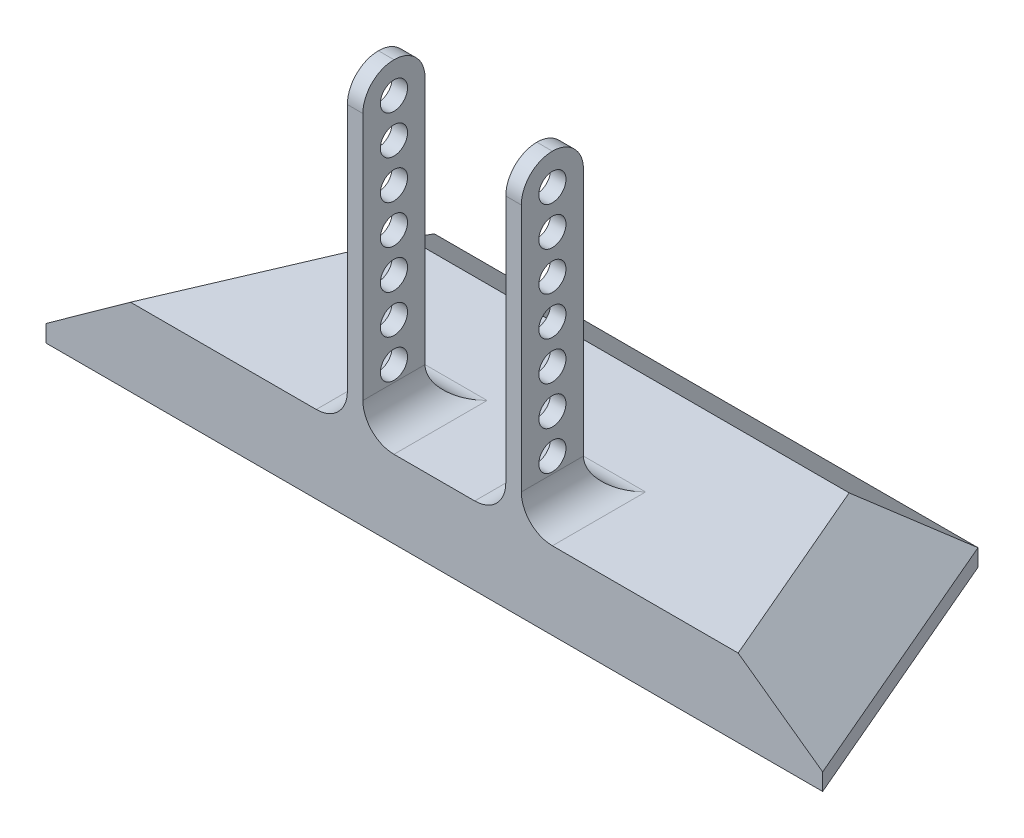
from build123d import *

# Parameters (mm, degrees)
SKETCH1_W               = 100
SKETCH1_H               = 35
BOSS_EXTRUDE1_DEPTH     = 10
CUT_EXTRUDE1_DEPTH      = 54.909646632
CHAMFER1_SIZE           = 10
CHAMFER1_SIZE2          = 7.812856265
SKETCH3_W               = 2
SKETCH3_H               = 8
BOSS_EXTRUDE2_DEPTH     = 40
FILLET1_R               = 4
SKETCH4_R               = 1.75
CUT_EXTRUDE2_DEPTH      = 81.942510463
LPATTERN1_COUNT         = 7
LPATTERN1_PITCH         = 5
MIRROR1_COPY_1_SKETCH_R = 1.75
MIRROR1_COPY_1_DEPTH    = 81.942510463
MIRROR1_COPY_2_SKETCH_R = 1.75
MIRROR1_COPY_2_DEPTH    = 81.942510463
MIRROR1_COPY_3_SKETCH_R = 1.75
MIRROR1_COPY_3_DEPTH    = 81.942510463
MIRROR1_COPY_4_SKETCH_R = 1.75
MIRROR1_COPY_4_DEPTH    = 81.942510463
MIRROR1_COPY_5_SKETCH_R = 1.75
MIRROR1_COPY_5_DEPTH    = 81.942510463
MIRROR1_COPY_6_SKETCH_R = 1.75
MIRROR1_COPY_6_DEPTH    = 81.942510463
FILLET1_OF_MIRROR1_R    = 4
FILLET2_R               = 4


with BuildPart() as part:
    # Sketch1 → Boss-Extrude1 (new body)
    with BuildSketch(Plane(origin=(0, 0, 0), x_dir=(1, 0, 0), z_dir=(0, 1, 0))):
        Rectangle(SKETCH1_W, SKETCH1_H)
    extrude(amount=BOSS_EXTRUDE1_DEPTH)

    # Sketch2 → Cut-Extrude1 (cut, through all)
    with BuildSketch(Plane(origin=(0, 10, 0), x_dir=(1, 0, 0), z_dir=(0, 1, 0))):
        Polygon((-50, 17.5), (-35, 17.5), (-50, -17.5), align=None)
        Polygon((50, 17.5), (35, 17.5), (50, -17.5), align=None)
    extrude(amount=-CUT_EXTRUDE1_DEPTH, mode=Mode.SUBTRACT)

    # Chamfer1
    chamfer1_edges = [part.edges().sort_by_distance(p)[0] for p in [
        (0, 10, -17.5),
        (-42.5, 10, 0),
        (42.5, 10, 0),
    ]]
    chamfer1_side = [part.faces().sort_by_distance(p)[0] for p in [
        (0, 10, 1.029411765),
    ]]
    chamfer(chamfer1_edges, length=CHAMFER1_SIZE, length2=CHAMFER1_SIZE2, reference=chamfer1_side[0])

    # Sketch3 → Boss-Extrude2 (add)
    with BuildSketch(Plane(origin=(0, 10, 0), x_dir=(1, 0, 0), z_dir=(0, 1, 0))):
        with Locations((-10.2, -13.5)):
            Rectangle(SKETCH3_W, SKETCH3_H)
    boss_extrude2 = extrude(amount=BOSS_EXTRUDE2_DEPTH)

    # Fillet1
    fillet1_edges = [part.edges().sort_by_distance(p)[0] for p in [
        (-10.2, 50, 9.5),
        (-10.2, 50, 17.5),
    ]]
    fillet(fillet1_edges, radius=FILLET1_R - 0.0001)  # a hair under: the kernel refuses the full size

    # Sketch4 → Cut-Extrude2 (cut, through all)
    with BuildSketch(Plane.ZY.offset(11.2)):
        with Locations((13.5, 46)):
            Circle(SKETCH4_R)
    cut_extrude2 = extrude(amount=-CUT_EXTRUDE2_DEPTH, mode=Mode.SUBTRACT)

    # LPattern1: Cut-Extrude2 ×7
    with Locations(*[(0, -i * LPATTERN1_PITCH, 0) for i in range(1, LPATTERN1_COUNT)]):
        add(cut_extrude2, mode=Mode.SUBTRACT)

    # Mirror1: Boss-Extrude2, Cut-Extrude2 across plane
    add(boss_extrude2.mirror(Plane(origin=(0, 0, 0), x_dir=(0, 0, 1), z_dir=(1, 0, 0))))
    add(cut_extrude2.mirror(Plane(origin=(0, 0, 0), x_dir=(0, 0, 1), z_dir=(1, 0, 0))), mode=Mode.SUBTRACT)

    # Mirror1 copy 1 sketch → Mirror1 copy 1 (cut, through all)
    with BuildSketch(Plane(origin=(11.2, -5, 0), x_dir=(0, 0, 1), z_dir=(1, 0, 0))):
        with Locations((13.5, -46)):
            Circle(MIRROR1_COPY_1_SKETCH_R)
    extrude(amount=-MIRROR1_COPY_1_DEPTH, mode=Mode.SUBTRACT)

    # Mirror1 copy 2 sketch → Mirror1 copy 2 (cut, through all)
    with BuildSketch(Plane(origin=(11.2, -10, 0), x_dir=(0, 0, 1), z_dir=(1, 0, 0))):
        with Locations((13.5, -46)):
            Circle(MIRROR1_COPY_2_SKETCH_R)
    extrude(amount=-MIRROR1_COPY_2_DEPTH, mode=Mode.SUBTRACT)

    # Mirror1 copy 3 sketch → Mirror1 copy 3 (cut, through all)
    with BuildSketch(Plane(origin=(11.2, -15, 0), x_dir=(0, 0, 1), z_dir=(1, 0, 0))):
        with Locations((13.5, -46)):
            Circle(MIRROR1_COPY_3_SKETCH_R)
    extrude(amount=-MIRROR1_COPY_3_DEPTH, mode=Mode.SUBTRACT)

    # Mirror1 copy 4 sketch → Mirror1 copy 4 (cut, through all)
    with BuildSketch(Plane(origin=(11.2, -20, 0), x_dir=(0, 0, 1), z_dir=(1, 0, 0))):
        with Locations((13.5, -46)):
            Circle(MIRROR1_COPY_4_SKETCH_R)
    extrude(amount=-MIRROR1_COPY_4_DEPTH, mode=Mode.SUBTRACT)

    # Mirror1 copy 5 sketch → Mirror1 copy 5 (cut, through all)
    with BuildSketch(Plane(origin=(11.2, -25, 0), x_dir=(0, 0, 1), z_dir=(1, 0, 0))):
        with Locations((13.5, -46)):
            Circle(MIRROR1_COPY_5_SKETCH_R)
    extrude(amount=-MIRROR1_COPY_5_DEPTH, mode=Mode.SUBTRACT)

    # Mirror1 copy 6 sketch → Mirror1 copy 6 (cut, through all)
    with BuildSketch(Plane(origin=(11.2, -30, 0), x_dir=(0, 0, 1), z_dir=(1, 0, 0))):
        with Locations((13.5, -46)):
            Circle(MIRROR1_COPY_6_SKETCH_R)
    extrude(amount=-MIRROR1_COPY_6_DEPTH, mode=Mode.SUBTRACT)

    # Fillet1 of Mirror1
    fillet1_of_mirror1_edges = [part.edges().sort_by_distance(p)[0] for p in [
        (10.2, 50, 9.5),
        (10.2, 50, 17.5),
    ]]
    fillet(fillet1_of_mirror1_edges, radius=FILLET1_OF_MIRROR1_R - 0.0001)  # a hair under: the kernel refuses the full size

    # Fillet2
    fillet2_edges = [part.edges().sort_by_distance(p)[0] for p in [
        (9.2, 10, 13.5),
        (10.2, 10, 9.5),
        (11.2, 10, 13.5),
        (-9.2, 10, 13.5),
        (-10.2, 10, 9.5),
        (-11.2, 10, 13.5),
    ]]
    fillet(fillet2_edges, radius=FILLET2_R)


solid = part.part
